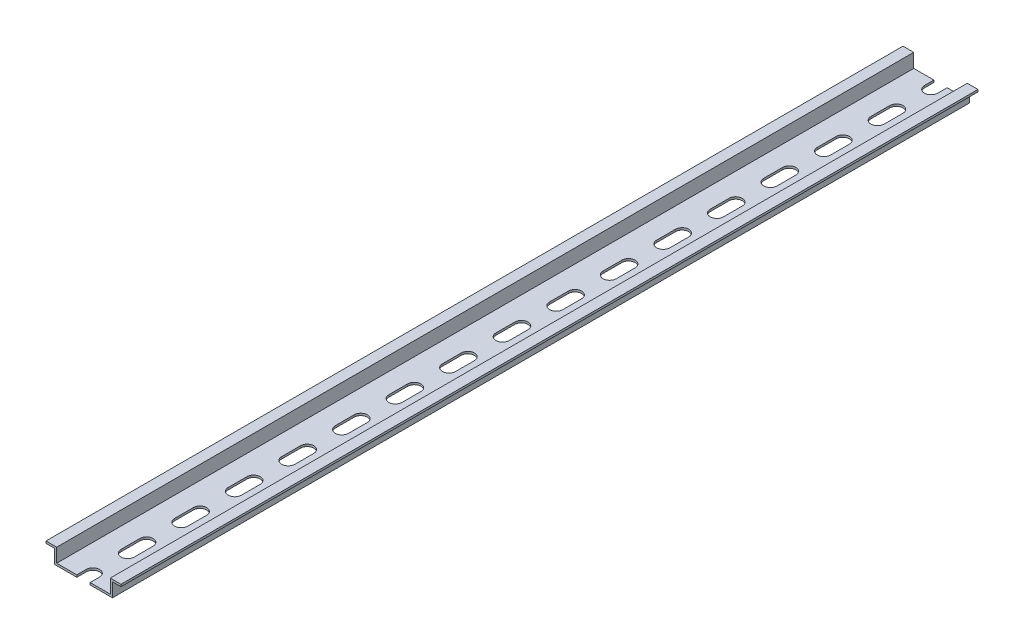
from build123d import *

# Parameters (mm, degrees)
SKETCH1_W           = 35
SKETCH1_H           = 2000
BOSS_EXTRUDE1_DEPTH = 7.5
SKETCH2_W           = 25
SKETCH2_H           = 6.5
CUT_EXTRUDE1_DEPTH  = 2006.509951855
CUT_EXTRUDE2_DEPTH  = 1906.117208871
SKETCH4_W           = 4
SKETCH4_H           = 6.5
CUT_EXTRUDE3_DEPTH  = 2006.509951855
SKETCH5_W           = 4
SKETCH5_H           = 6.5
CUT_EXTRUDE4_DEPTH  = 2006.509951855
CUT_EXTRUDE5_DEPTH  = 1906.117208871
CUT_EXTRUDE6_DEPTH  = 1906.113534553
CUT_EXTRUDE7_DEPTH  = 1906.113534553
CUT_EXTRUDE8_DEPTH  = 1906.113534553
CUT_EXTRUDE9_DEPTH  = 1906.113534553
CUT_EXTRUDE10_DEPTH = 1906.113534553
CUT_EXTRUDE11_DEPTH = 1906.113534553
CUT_EXTRUDE12_DEPTH = 1906.113534553
CUT_EXTRUDE13_DEPTH = 1906.113534553
CUT_EXTRUDE14_DEPTH = 1906.113534553
CUT_EXTRUDE15_DEPTH = 1906.113534553
CUT_EXTRUDE16_DEPTH = 1906.113534553
CUT_EXTRUDE17_DEPTH = 1906.113534553
CUT_EXTRUDE18_DEPTH = 1906.113534553
CUT_EXTRUDE19_DEPTH = 1906.113534553
CUT_EXTRUDE20_DEPTH = 1906.113534553
CUT_EXTRUDE21_DEPTH = 1906.113534553
CUT_EXTRUDE22_DEPTH = 1906.113534553
CUT_EXTRUDE23_DEPTH = 1906.113534553
CUT_EXTRUDE24_DEPTH = 1906.113534553
CUT_EXTRUDE25_DEPTH = 1906.113534553
CUT_EXTRUDE26_DEPTH = 1906.113534553
CUT_EXTRUDE27_DEPTH = 1906.113534553
CUT_EXTRUDE28_DEPTH = 1906.113534553
CUT_EXTRUDE29_DEPTH = 1906.113534553
CUT_EXTRUDE30_DEPTH = 1906.113534553
CUT_EXTRUDE31_DEPTH = 1906.113534553
CUT_EXTRUDE32_DEPTH = 1906.113534553
CUT_EXTRUDE33_DEPTH = 1906.113534553
CUT_EXTRUDE34_DEPTH = 1906.113534553
CUT_EXTRUDE35_DEPTH = 1906.113534553
CUT_EXTRUDE36_DEPTH = 1906.113534553
CUT_EXTRUDE37_DEPTH = 1906.113534553
CUT_EXTRUDE38_DEPTH = 1906.113534553
CUT_EXTRUDE39_DEPTH = 1906.113534553
CUT_EXTRUDE40_DEPTH = 1906.113534553
CUT_EXTRUDE41_DEPTH = 1906.113534553
CUT_EXTRUDE42_DEPTH = 1906.113534553
CUT_EXTRUDE43_DEPTH = 1906.113534553
CUT_EXTRUDE44_DEPTH = 1906.113534553
CUT_EXTRUDE45_DEPTH = 1906.113534553
CUT_EXTRUDE46_DEPTH = 1906.113534553
CUT_EXTRUDE47_DEPTH = 1906.113534553
CUT_EXTRUDE48_DEPTH = 1906.113534553
CUT_EXTRUDE49_DEPTH = 1906.113534553
CUT_EXTRUDE50_DEPTH = 1906.113534553
CUT_EXTRUDE51_DEPTH = 1906.113534553
CUT_EXTRUDE52_DEPTH = 1906.113534553
CUT_EXTRUDE53_DEPTH = 1906.113534553
CUT_EXTRUDE54_DEPTH = 1906.113534553
CUT_EXTRUDE55_DEPTH = 1906.113534553
CUT_EXTRUDE56_DEPTH = 1906.113534553
CUT_EXTRUDE57_DEPTH = 1906.113534553
CUT_EXTRUDE58_DEPTH = 1906.113534553
CUT_EXTRUDE59_DEPTH = 1906.113534553
CUT_EXTRUDE60_DEPTH = 1906.113534553
CUT_EXTRUDE61_DEPTH = 1906.113534553
CUT_EXTRUDE62_DEPTH = 1906.113534553
CUT_EXTRUDE63_DEPTH = 1906.113534553
CUT_EXTRUDE64_DEPTH = 1906.113534553
CUT_EXTRUDE65_DEPTH = 1906.113534553
CUT_EXTRUDE66_DEPTH = 1906.113534553
CUT_EXTRUDE67_DEPTH = 1906.113534553
CUT_EXTRUDE68_DEPTH = 1906.113534553
CUT_EXTRUDE69_DEPTH = 1906.113534553
CUT_EXTRUDE70_DEPTH = 1906.113534553
CUT_EXTRUDE71_DEPTH = 1906.113534553
CUT_EXTRUDE72_DEPTH = 1906.113534553
CUT_EXTRUDE73_DEPTH = 1906.113534553
CUT_EXTRUDE74_DEPTH = 1906.113534553
CUT_EXTRUDE75_DEPTH = 1906.113534553
CUT_EXTRUDE76_DEPTH = 1906.113534553
CUT_EXTRUDE77_DEPTH = 1906.113534553
CUT_EXTRUDE78_DEPTH = 1906.113534553
CUT_EXTRUDE79_DEPTH = 1906.113534553
CUT_EXTRUDE80_DEPTH = 1906.113534553
CUT_EXTRUDE81_DEPTH = 1906.113534553
CUT_EXTRUDE82_DEPTH = 1906.113534553
CUT_EXTRUDE83_DEPTH = 1906.113534553
CUT_EXTRUDE84_DEPTH = 1906.117208871
SKETCH86_W          = 69.374183468
SKETCH86_H          = 40.086929233
CUT_EXTRUDE85_DEPTH = 1600


with BuildPart() as part:
    # Sketch1 → Boss-Extrude1 (new body)
    with BuildSketch(Plane(origin=(0, -44.02511479, 0), x_dir=(1, 0, 0), z_dir=(0, 1, 0))):
        with Locations((121.838901733, 900)):
            Rectangle(SKETCH1_W, SKETCH1_H)
    extrude(amount=-BOSS_EXTRUDE1_DEPTH)

    # Sketch2 → Cut-Extrude1 (cut, through all)
    with BuildSketch(Plane(origin=(0, 0, -1900), x_dir=(-1, 0, 0), z_dir=(0, 0, -1))):
        with Locations((-121.838901733, -47.27511479)):
            Rectangle(SKETCH2_W, SKETCH2_H)
    extrude(amount=-CUT_EXTRUDE1_DEPTH, mode=Mode.SUBTRACT)

    # Sketch3 → Cut-Extrude2 (cut, through all)
    with BuildSketch(Plane.XZ.offset(51.52511479)):
        with BuildLine():
            Line((118.738901733, -1900), (124.938901733, -1900))
            Line((124.938901733, -1900), (124.938901733, -1895.6))
            ThreePointArc((124.938901733, -1895.6), (121.838901733, -1892.5), (118.738901733, -1895.6))
            Line((118.738901733, -1895.6), (118.738901733, -1900))
        make_face()
    extrude(amount=-CUT_EXTRUDE2_DEPTH, mode=Mode.SUBTRACT)

    # Sketch4 → Cut-Extrude3 (cut, through all)
    with BuildSketch(Plane(origin=(0, 0, -1900), x_dir=(-1, 0, 0), z_dir=(0, 0, -1))):
        with Locations((-106.338901733, -48.27511479)):
            Rectangle(SKETCH4_W, SKETCH4_H)
    extrude(amount=-CUT_EXTRUDE3_DEPTH, mode=Mode.SUBTRACT)

    # Sketch5 → Cut-Extrude4 (cut, through all)
    with BuildSketch(Plane(origin=(0, 0, -1900), x_dir=(-1, 0, 0), z_dir=(0, 0, -1))):
        with Locations((-137.338901733, -48.27511479)):
            Rectangle(SKETCH5_W, SKETCH5_H)
    extrude(amount=-CUT_EXTRUDE4_DEPTH, mode=Mode.SUBTRACT)

    # Sketch6 → Cut-Extrude5 (cut, through all)
    with BuildSketch(Plane.XZ.offset(51.52511479)):
        with BuildLine():
            Line((118.738901733, 100), (118.738901733, 95.6))
            ThreePointArc((118.738901733, 95.6), (121.838901733, 92.5), (124.938901733, 95.6))
            Line((124.938901733, 95.6), (124.938901733, 100))
            Line((124.938901733, 100), (118.738901733, 100))
        make_face()
    extrude(amount=-CUT_EXTRUDE5_DEPTH, mode=Mode.SUBTRACT)

    # Sketch7 → Cut-Extrude6 (cut, through all)
    with BuildSketch(Plane(origin=(0, -50.52511479, 0), x_dir=(-1, 0, 0), z_dir=(0, 1, 0))):
        with BuildLine():
            Line((-118.738901733, -54.4), (-118.738901733, -45.6))
            ThreePointArc((-118.738901733, -45.6), (-121.838901733, -42.5), (-124.938901733, -45.6))
            Line((-124.938901733, -45.6), (-124.938901733, -54.4))
            ThreePointArc((-124.938901733, -54.4), (-121.838901733, -57.5), (-118.738901733, -54.4))
        make_face()
    extrude(amount=-CUT_EXTRUDE6_DEPTH, mode=Mode.SUBTRACT)

    # Sketch8 → Cut-Extrude7 (cut, through all)
    with BuildSketch(Plane(origin=(0, -50.52511479, 0), x_dir=(-1, 0, 0), z_dir=(0, 1, 0))):
        with BuildLine():
            Line((-124.938901733, 29.4), (-124.938901733, 20.6))
            ThreePointArc((-124.938901733, 20.6), (-121.838901733, 17.5), (-118.738901733, 20.6))
            Line((-118.738901733, 20.6), (-118.738901733, 29.4))
            ThreePointArc((-118.738901733, 29.4), (-121.838901733, 32.5), (-124.938901733, 29.4))
        make_face()
    extrude(amount=-CUT_EXTRUDE7_DEPTH, mode=Mode.SUBTRACT)

    # Sketch9 → Cut-Extrude8 (cut, through all)
    with BuildSketch(Plane(origin=(0, -50.52511479, 0), x_dir=(-1, 0, 0), z_dir=(0, 1, 0))):
        with BuildLine():
            Line((-118.738901733, -1829.4), (-118.738901733, -1820.6))
            ThreePointArc((-118.738901733, -1820.6), (-121.838901733, -1817.5), (-124.938901733, -1820.6))
            Line((-124.938901733, -1820.6), (-124.938901733, -1829.4))
            ThreePointArc((-124.938901733, -1829.4), (-121.838901733, -1832.5), (-118.738901733, -1829.4))
        make_face()
    extrude(amount=-CUT_EXTRUDE8_DEPTH, mode=Mode.SUBTRACT)

    # Sketch10 → Cut-Extrude9 (cut, through all)
    with BuildSketch(Plane(origin=(0, -50.52511479, 0), x_dir=(-1, 0, 0), z_dir=(0, 1, 0))):
        with BuildLine():
            Line((-118.738901733, -1529.4), (-118.738901733, -1520.6))
            ThreePointArc((-118.738901733, -1520.6), (-121.838901733, -1517.5), (-124.938901733, -1520.6))
            Line((-124.938901733, -1520.6), (-124.938901733, -1529.4))
            ThreePointArc((-124.938901733, -1529.4), (-121.838901733, -1532.5), (-118.738901733, -1529.4))
        make_face()
    extrude(amount=-CUT_EXTRUDE9_DEPTH, mode=Mode.SUBTRACT)

    # Sketch11 → Cut-Extrude10 (cut, through all)
    with BuildSketch(Plane(origin=(0, -50.52511479, 0), x_dir=(-1, 0, 0), z_dir=(0, 1, 0))):
        with BuildLine():
            Line((-124.938901733, -1120.6), (-124.938901733, -1129.4))
            ThreePointArc((-124.938901733, -1129.4), (-121.838901733, -1132.5), (-118.738901733, -1129.4))
            Line((-118.738901733, -1129.4), (-118.738901733, -1120.6))
            ThreePointArc((-118.738901733, -1120.6), (-121.838901733, -1117.5), (-124.938901733, -1120.6))
        make_face()
    extrude(amount=-CUT_EXTRUDE10_DEPTH, mode=Mode.SUBTRACT)

    # Sketch12 → Cut-Extrude11 (cut, through all)
    with BuildSketch(Plane(origin=(0, -50.52511479, 0), x_dir=(-1, 0, 0), z_dir=(0, 1, 0))):
        with BuildLine():
            Line((-118.738901733, -404.4), (-118.738901733, -395.6))
            ThreePointArc((-118.738901733, -395.6), (-121.838901733, -392.5), (-124.938901733, -395.6))
            Line((-124.938901733, -395.6), (-124.938901733, -404.4))
            ThreePointArc((-124.938901733, -404.4), (-121.838901733, -407.5), (-118.738901733, -404.4))
        make_face()
    extrude(amount=-CUT_EXTRUDE11_DEPTH, mode=Mode.SUBTRACT)

    # Sketch13 → Cut-Extrude12 (cut, through all)
    with BuildSketch(Plane(origin=(0, -50.52511479, 0), x_dir=(-1, 0, 0), z_dir=(0, 1, 0))):
        with BuildLine():
            Line((-118.738901733, -304.4), (-118.738901733, -295.6))
            ThreePointArc((-118.738901733, -295.6), (-121.838901733, -292.5), (-124.938901733, -295.6))
            Line((-124.938901733, -295.6), (-124.938901733, -304.4))
            ThreePointArc((-124.938901733, -304.4), (-121.838901733, -307.5), (-118.738901733, -304.4))
        make_face()
    extrude(amount=-CUT_EXTRUDE12_DEPTH, mode=Mode.SUBTRACT)

    # Sketch14 → Cut-Extrude13 (cut, through all)
    with BuildSketch(Plane(origin=(0, -50.52511479, 0), x_dir=(-1, 0, 0), z_dir=(0, 1, 0))):
        with BuildLine():
            Line((-124.938901733, -245.6), (-124.938901733, -254.4))
            ThreePointArc((-124.938901733, -254.4), (-121.838901733, -257.5), (-118.738901733, -254.4))
            Line((-118.738901733, -254.4), (-118.738901733, -245.6))
            ThreePointArc((-118.738901733, -245.6), (-121.838901733, -242.5), (-124.938901733, -245.6))
        make_face()
    extrude(amount=-CUT_EXTRUDE13_DEPTH, mode=Mode.SUBTRACT)

    # Sketch15 → Cut-Extrude14 (cut, through all)
    with BuildSketch(Plane(origin=(0, -50.52511479, 0), x_dir=(-1, 0, 0), z_dir=(0, 1, 0))):
        with BuildLine():
            Line((-118.738901733, 45.6), (-118.738901733, 54.4))
            ThreePointArc((-118.738901733, 54.4), (-121.838901733, 57.5), (-124.938901733, 54.4))
            Line((-124.938901733, 54.4), (-124.938901733, 45.6))
            ThreePointArc((-124.938901733, 45.6), (-121.838901733, 42.5), (-118.738901733, 45.6))
        make_face()
    extrude(amount=-CUT_EXTRUDE14_DEPTH, mode=Mode.SUBTRACT)

    # Sketch16 → Cut-Extrude15 (cut, through all)
    with BuildSketch(Plane(origin=(0, -50.52511479, 0), x_dir=(-1, 0, 0), z_dir=(0, 1, 0))):
        with BuildLine():
            Line((-118.738901733, -279.4), (-118.738901733, -270.6))
            ThreePointArc((-118.738901733, -270.6), (-121.838901733, -267.5), (-124.938901733, -270.6))
            Line((-124.938901733, -270.6), (-124.938901733, -279.4))
            ThreePointArc((-124.938901733, -279.4), (-121.838901733, -282.5), (-118.738901733, -279.4))
        make_face()
    extrude(amount=-CUT_EXTRUDE15_DEPTH, mode=Mode.SUBTRACT)

    # Sketch17 → Cut-Extrude16 (cut, through all)
    with BuildSketch(Plane(origin=(0, -50.52511479, 0), x_dir=(-1, 0, 0), z_dir=(0, 1, 0))):
        with BuildLine():
            Line((-124.938901733, -920.6), (-124.938901733, -929.4))
            ThreePointArc((-124.938901733, -929.4), (-121.838901733, -932.5), (-118.738901733, -929.4))
            Line((-118.738901733, -929.4), (-118.738901733, -920.6))
            ThreePointArc((-118.738901733, -920.6), (-121.838901733, -917.5), (-124.938901733, -920.6))
        make_face()
    extrude(amount=-CUT_EXTRUDE16_DEPTH, mode=Mode.SUBTRACT)

    # Sketch18 → Cut-Extrude17 (cut, through all)
    with BuildSketch(Plane(origin=(0, -50.52511479, 0), x_dir=(-1, 0, 0), z_dir=(0, 1, 0))):
        with BuildLine():
            Line((-118.738901733, -1504.4), (-118.738901733, -1495.6))
            ThreePointArc((-118.738901733, -1495.6), (-121.838901733, -1492.5), (-124.938901733, -1495.6))
            Line((-124.938901733, -1495.6), (-124.938901733, -1504.4))
            ThreePointArc((-124.938901733, -1504.4), (-121.838901733, -1507.5), (-118.738901733, -1504.4))
        make_face()
    extrude(amount=-CUT_EXTRUDE17_DEPTH, mode=Mode.SUBTRACT)

    # Sketch19 → Cut-Extrude18 (cut, through all)
    with BuildSketch(Plane(origin=(0, -50.52511479, 0), x_dir=(-1, 0, 0), z_dir=(0, 1, 0))):
        with BuildLine():
            Line((-124.938901733, -970.6), (-124.938901733, -979.4))
            ThreePointArc((-124.938901733, -979.4), (-121.838901733, -982.5), (-118.738901733, -979.4))
            Line((-118.738901733, -979.4), (-118.738901733, -970.6))
            ThreePointArc((-118.738901733, -970.6), (-121.838901733, -967.5), (-124.938901733, -970.6))
        make_face()
    extrude(amount=-CUT_EXTRUDE18_DEPTH, mode=Mode.SUBTRACT)

    # Sketch20 → Cut-Extrude19 (cut, through all)
    with BuildSketch(Plane(origin=(0, -50.52511479, 0), x_dir=(-1, 0, 0), z_dir=(0, 1, 0))):
        with BuildLine():
            Line((-118.738901733, -204.4), (-118.738901733, -195.6))
            ThreePointArc((-118.738901733, -195.6), (-121.838901733, -192.5), (-124.938901733, -195.6))
            Line((-124.938901733, -195.6), (-124.938901733, -204.4))
            ThreePointArc((-124.938901733, -204.4), (-121.838901733, -207.5), (-118.738901733, -204.4))
        make_face()
    extrude(amount=-CUT_EXTRUDE19_DEPTH, mode=Mode.SUBTRACT)

    # Sketch21 → Cut-Extrude20 (cut, through all)
    with BuildSketch(Plane(origin=(0, -50.52511479, 0), x_dir=(-1, 0, 0), z_dir=(0, 1, 0))):
        with BuildLine():
            Line((-118.738901733, -79.4), (-118.738901733, -70.6))
            ThreePointArc((-118.738901733, -70.6), (-121.838901733, -67.5), (-124.938901733, -70.6))
            Line((-124.938901733, -70.6), (-124.938901733, -79.4))
            ThreePointArc((-124.938901733, -79.4), (-121.838901733, -82.5), (-118.738901733, -79.4))
        make_face()
    extrude(amount=-CUT_EXTRUDE20_DEPTH, mode=Mode.SUBTRACT)

    # Sketch22 → Cut-Extrude21 (cut, through all)
    with BuildSketch(Plane(origin=(0, -50.52511479, 0), x_dir=(-1, 0, 0), z_dir=(0, 1, 0))):
        with BuildLine():
            Line((-118.738901733, -1379.4), (-118.738901733, -1370.6))
            ThreePointArc((-118.738901733, -1370.6), (-121.838901733, -1367.5), (-124.938901733, -1370.6))
            Line((-124.938901733, -1370.6), (-124.938901733, -1379.4))
            ThreePointArc((-124.938901733, -1379.4), (-121.838901733, -1382.5), (-118.738901733, -1379.4))
        make_face()
    extrude(amount=-CUT_EXTRUDE21_DEPTH, mode=Mode.SUBTRACT)

    # Sketch23 → Cut-Extrude22 (cut, through all)
    with BuildSketch(Plane(origin=(0, -50.52511479, 0), x_dir=(-1, 0, 0), z_dir=(0, 1, 0))):
        with BuildLine():
            Line((-118.738901733, -1604.4), (-118.738901733, -1595.6))
            ThreePointArc((-118.738901733, -1595.6), (-121.838901733, -1592.5), (-124.938901733, -1595.6))
            Line((-124.938901733, -1595.6), (-124.938901733, -1604.4))
            ThreePointArc((-124.938901733, -1604.4), (-121.838901733, -1607.5), (-118.738901733, -1604.4))
        make_face()
    extrude(amount=-CUT_EXTRUDE22_DEPTH, mode=Mode.SUBTRACT)

    # Sketch24 → Cut-Extrude23 (cut, through all)
    with BuildSketch(Plane(origin=(0, -50.52511479, 0), x_dir=(-1, 0, 0), z_dir=(0, 1, 0))):
        with BuildLine():
            Line((-118.738901733, -1254.4), (-118.738901733, -1245.6))
            ThreePointArc((-118.738901733, -1245.6), (-121.838901733, -1242.5), (-124.938901733, -1245.6))
            Line((-124.938901733, -1245.6), (-124.938901733, -1254.4))
            ThreePointArc((-124.938901733, -1254.4), (-121.838901733, -1257.5), (-118.738901733, -1254.4))
        make_face()
    extrude(amount=-CUT_EXTRUDE23_DEPTH, mode=Mode.SUBTRACT)

    # Sketch25 → Cut-Extrude24 (cut, through all)
    with BuildSketch(Plane(origin=(0, -50.52511479, 0), x_dir=(-1, 0, 0), z_dir=(0, 1, 0))):
        with BuildLine():
            Line((-118.738901733, -154.4), (-118.738901733, -145.6))
            ThreePointArc((-118.738901733, -145.6), (-121.838901733, -142.5), (-124.938901733, -145.6))
            Line((-124.938901733, -145.6), (-124.938901733, -154.4))
            ThreePointArc((-124.938901733, -154.4), (-121.838901733, -157.5), (-118.738901733, -154.4))
        make_face()
    extrude(amount=-CUT_EXTRUDE24_DEPTH, mode=Mode.SUBTRACT)

    # Sketch26 → Cut-Extrude25 (cut, through all)
    with BuildSketch(Plane(origin=(0, -50.52511479, 0), x_dir=(-1, 0, 0), z_dir=(0, 1, 0))):
        with BuildLine():
            Line((-118.738901733, -1554.4), (-118.738901733, -1545.6))
            ThreePointArc((-118.738901733, -1545.6), (-121.838901733, -1542.5), (-124.938901733, -1545.6))
            Line((-124.938901733, -1545.6), (-124.938901733, -1554.4))
            ThreePointArc((-124.938901733, -1554.4), (-121.838901733, -1557.5), (-118.738901733, -1554.4))
        make_face()
    extrude(amount=-CUT_EXTRUDE25_DEPTH, mode=Mode.SUBTRACT)

    # Sketch27 → Cut-Extrude26 (cut, through all)
    with BuildSketch(Plane(origin=(0, -50.52511479, 0), x_dir=(-1, 0, 0), z_dir=(0, 1, 0))):
        with BuildLine():
            Line((-124.938901733, -1020.6), (-124.938901733, -1029.4))
            ThreePointArc((-124.938901733, -1029.4), (-121.838901733, -1032.5), (-118.738901733, -1029.4))
            Line((-118.738901733, -1029.4), (-118.738901733, -1020.6))
            ThreePointArc((-118.738901733, -1020.6), (-121.838901733, -1017.5), (-124.938901733, -1020.6))
        make_face()
    extrude(amount=-CUT_EXTRUDE26_DEPTH, mode=Mode.SUBTRACT)

    # Sketch28 → Cut-Extrude27 (cut, through all)
    with BuildSketch(Plane(origin=(0, -50.52511479, 0), x_dir=(-1, 0, 0), z_dir=(0, 1, 0))):
        with BuildLine():
            Line((-118.738901733, -1629.4), (-118.738901733, -1620.6))
            ThreePointArc((-118.738901733, -1620.6), (-121.838901733, -1617.5), (-124.938901733, -1620.6))
            Line((-124.938901733, -1620.6), (-124.938901733, -1629.4))
            ThreePointArc((-124.938901733, -1629.4), (-121.838901733, -1632.5), (-118.738901733, -1629.4))
        make_face()
    extrude(amount=-CUT_EXTRUDE27_DEPTH, mode=Mode.SUBTRACT)

    # Sketch29 → Cut-Extrude28 (cut, through all)
    with BuildSketch(Plane(origin=(0, -50.52511479, 0), x_dir=(-1, 0, 0), z_dir=(0, 1, 0))):
        with BuildLine():
            Line((-118.738901733, -529.4), (-118.738901733, -520.6))
            ThreePointArc((-118.738901733, -520.6), (-121.838901733, -517.5), (-124.938901733, -520.6))
            Line((-124.938901733, -520.6), (-124.938901733, -529.4))
            ThreePointArc((-124.938901733, -529.4), (-121.838901733, -532.5), (-118.738901733, -529.4))
        make_face()
    extrude(amount=-CUT_EXTRUDE28_DEPTH, mode=Mode.SUBTRACT)

    # Sketch30 → Cut-Extrude29 (cut, through all)
    with BuildSketch(Plane(origin=(0, -50.52511479, 0), x_dir=(-1, 0, 0), z_dir=(0, 1, 0))):
        with BuildLine():
            Line((-118.738901733, -1104.4), (-118.738901733, -1095.6))
            ThreePointArc((-118.738901733, -1095.6), (-121.838901733, -1092.5), (-124.938901733, -1095.6))
            Line((-124.938901733, -1095.6), (-124.938901733, -1104.4))
            ThreePointArc((-124.938901733, -1104.4), (-121.838901733, -1107.5), (-118.738901733, -1104.4))
        make_face()
    extrude(amount=-CUT_EXTRUDE29_DEPTH, mode=Mode.SUBTRACT)

    # Sketch31 → Cut-Extrude30 (cut, through all)
    with BuildSketch(Plane(origin=(0, -50.52511479, 0), x_dir=(-1, 0, 0), z_dir=(0, 1, 0))):
        with BuildLine():
            Line((-118.738901733, -429.4), (-118.738901733, -420.6))
            ThreePointArc((-118.738901733, -420.6), (-121.838901733, -417.5), (-124.938901733, -420.6))
            Line((-124.938901733, -420.6), (-124.938901733, -429.4))
            ThreePointArc((-124.938901733, -429.4), (-121.838901733, -432.5), (-118.738901733, -429.4))
        make_face()
    extrude(amount=-CUT_EXTRUDE30_DEPTH, mode=Mode.SUBTRACT)

    # Sketch32 → Cut-Extrude31 (cut, through all)
    with BuildSketch(Plane(origin=(0, -50.52511479, 0), x_dir=(-1, 0, 0), z_dir=(0, 1, 0))):
        with BuildLine():
            Line((-118.738901733, -829.4), (-118.738901733, -820.6))
            ThreePointArc((-118.738901733, -820.6), (-121.838901733, -817.5), (-124.938901733, -820.6))
            Line((-124.938901733, -820.6), (-124.938901733, -829.4))
            ThreePointArc((-124.938901733, -829.4), (-121.838901733, -832.5), (-118.738901733, -829.4))
        make_face()
    extrude(amount=-CUT_EXTRUDE31_DEPTH, mode=Mode.SUBTRACT)

    # Sketch33 → Cut-Extrude32 (cut, through all)
    with BuildSketch(Plane(origin=(0, -50.52511479, 0), x_dir=(-1, 0, 0), z_dir=(0, 1, 0))):
        with BuildLine():
            Line((-124.938901733, -870.6), (-124.938901733, -879.4))
            ThreePointArc((-124.938901733, -879.4), (-121.838901733, -882.5), (-118.738901733, -879.4))
            Line((-118.738901733, -879.4), (-118.738901733, -870.6))
            ThreePointArc((-118.738901733, -870.6), (-121.838901733, -867.5), (-124.938901733, -870.6))
        make_face()
    extrude(amount=-CUT_EXTRUDE32_DEPTH, mode=Mode.SUBTRACT)

    # Sketch34 → Cut-Extrude33 (cut, through all)
    with BuildSketch(Plane(origin=(0, -50.52511479, 0), x_dir=(-1, 0, 0), z_dir=(0, 1, 0))):
        with BuildLine():
            Line((-118.738901733, -4.4), (-118.738901733, 4.4))
            ThreePointArc((-118.738901733, 4.4), (-121.838901733, 7.5), (-124.938901733, 4.4))
            Line((-124.938901733, 4.4), (-124.938901733, -4.4))
            ThreePointArc((-124.938901733, -4.4), (-121.838901733, -7.5), (-118.738901733, -4.4))
        make_face()
    extrude(amount=-CUT_EXTRUDE33_DEPTH, mode=Mode.SUBTRACT)

    # Sketch35 → Cut-Extrude34 (cut, through all)
    with BuildSketch(Plane(origin=(0, -50.52511479, 0), x_dir=(-1, 0, 0), z_dir=(0, 1, 0))):
        with BuildLine():
            Line((-118.738901733, -104.4), (-118.738901733, -95.6))
            ThreePointArc((-118.738901733, -95.6), (-121.838901733, -92.5), (-124.938901733, -95.6))
            Line((-124.938901733, -95.6), (-124.938901733, -104.4))
            ThreePointArc((-124.938901733, -104.4), (-121.838901733, -107.5), (-118.738901733, -104.4))
        make_face()
    extrude(amount=-CUT_EXTRUDE34_DEPTH, mode=Mode.SUBTRACT)

    # Sketch36 → Cut-Extrude35 (cut, through all)
    with BuildSketch(Plane(origin=(0, -50.52511479, 0), x_dir=(-1, 0, 0), z_dir=(0, 1, 0))):
        with BuildLine():
            Line((-118.738901733, -754.4), (-118.738901733, -745.6))
            ThreePointArc((-118.738901733, -745.6), (-121.838901733, -742.5), (-124.938901733, -745.6))
            Line((-124.938901733, -745.6), (-124.938901733, -754.4))
            ThreePointArc((-124.938901733, -754.4), (-121.838901733, -757.5), (-118.738901733, -754.4))
        make_face()
    extrude(amount=-CUT_EXTRUDE35_DEPTH, mode=Mode.SUBTRACT)

    # Sketch37 → Cut-Extrude36 (cut, through all)
    with BuildSketch(Plane(origin=(0, -50.52511479, 0), x_dir=(-1, 0, 0), z_dir=(0, 1, 0))):
        with BuildLine():
            Line((-124.938901733, -1570.6), (-124.938901733, -1579.4))
            ThreePointArc((-124.938901733, -1579.4), (-121.838901733, -1582.5), (-118.738901733, -1579.4))
            Line((-118.738901733, -1579.4), (-118.738901733, -1570.6))
            ThreePointArc((-118.738901733, -1570.6), (-121.838901733, -1567.5), (-124.938901733, -1570.6))
        make_face()
    extrude(amount=-CUT_EXTRUDE36_DEPTH, mode=Mode.SUBTRACT)

    # Sketch38 → Cut-Extrude37 (cut, through all)
    with BuildSketch(Plane(origin=(0, -50.52511479, 0), x_dir=(-1, 0, 0), z_dir=(0, 1, 0))):
        with BuildLine():
            Line((-118.738901733, -1404.4), (-118.738901733, -1395.6))
            ThreePointArc((-118.738901733, -1395.6), (-121.838901733, -1392.5), (-124.938901733, -1395.6))
            Line((-124.938901733, -1395.6), (-124.938901733, -1404.4))
            ThreePointArc((-124.938901733, -1404.4), (-121.838901733, -1407.5), (-118.738901733, -1404.4))
        make_face()
    extrude(amount=-CUT_EXTRUDE37_DEPTH, mode=Mode.SUBTRACT)

    # Sketch39 → Cut-Extrude38 (cut, through all)
    with BuildSketch(Plane(origin=(0, -50.52511479, 0), x_dir=(-1, 0, 0), z_dir=(0, 1, 0))):
        with BuildLine():
            Line((-118.738901733, -1329.4), (-118.738901733, -1320.6))
            ThreePointArc((-118.738901733, -1320.6), (-121.838901733, -1317.5), (-124.938901733, -1320.6))
            Line((-124.938901733, -1320.6), (-124.938901733, -1329.4))
            ThreePointArc((-124.938901733, -1329.4), (-121.838901733, -1332.5), (-118.738901733, -1329.4))
        make_face()
    extrude(amount=-CUT_EXTRUDE38_DEPTH, mode=Mode.SUBTRACT)

    # Sketch40 → Cut-Extrude39 (cut, through all)
    with BuildSketch(Plane(origin=(0, -50.52511479, 0), x_dir=(-1, 0, 0), z_dir=(0, 1, 0))):
        with BuildLine():
            Line((-118.738901733, -904.4), (-118.738901733, -895.6))
            ThreePointArc((-118.738901733, -895.6), (-121.838901733, -892.5), (-124.938901733, -895.6))
            Line((-124.938901733, -895.6), (-124.938901733, -904.4))
            ThreePointArc((-124.938901733, -904.4), (-121.838901733, -907.5), (-118.738901733, -904.4))
        make_face()
    extrude(amount=-CUT_EXTRUDE39_DEPTH, mode=Mode.SUBTRACT)

    # Sketch41 → Cut-Extrude40 (cut, through all)
    with BuildSketch(Plane(origin=(0, -50.52511479, 0), x_dir=(-1, 0, 0), z_dir=(0, 1, 0))):
        with BuildLine():
            Line((-118.738901733, -1854.4), (-118.738901733, -1845.6))
            ThreePointArc((-118.738901733, -1845.6), (-121.838901733, -1842.5), (-124.938901733, -1845.6))
            Line((-124.938901733, -1845.6), (-124.938901733, -1854.4))
            ThreePointArc((-124.938901733, -1854.4), (-121.838901733, -1857.5), (-118.738901733, -1854.4))
        make_face()
    extrude(amount=-CUT_EXTRUDE40_DEPTH, mode=Mode.SUBTRACT)

    # Sketch42 → Cut-Extrude41 (cut, through all)
    with BuildSketch(Plane(origin=(0, -50.52511479, 0), x_dir=(-1, 0, 0), z_dir=(0, 1, 0))):
        with BuildLine():
            Line((-124.938901733, -670.6), (-124.938901733, -679.4))
            ThreePointArc((-124.938901733, -679.4), (-121.838901733, -682.5), (-118.738901733, -679.4))
            Line((-118.738901733, -679.4), (-118.738901733, -670.6))
            ThreePointArc((-118.738901733, -670.6), (-121.838901733, -667.5), (-124.938901733, -670.6))
        make_face()
    extrude(amount=-CUT_EXTRUDE41_DEPTH, mode=Mode.SUBTRACT)

    # Sketch43 → Cut-Extrude42 (cut, through all)
    with BuildSketch(Plane(origin=(0, -50.52511479, 0), x_dir=(-1, 0, 0), z_dir=(0, 1, 0))):
        with BuildLine():
            Line((-118.738901733, -1804.4), (-118.738901733, -1795.6))
            ThreePointArc((-118.738901733, -1795.6), (-121.838901733, -1792.5), (-124.938901733, -1795.6))
            Line((-124.938901733, -1795.6), (-124.938901733, -1804.4))
            ThreePointArc((-124.938901733, -1804.4), (-121.838901733, -1807.5), (-118.738901733, -1804.4))
        make_face()
    extrude(amount=-CUT_EXTRUDE42_DEPTH, mode=Mode.SUBTRACT)

    # Sketch44 → Cut-Extrude43 (cut, through all)
    with BuildSketch(Plane(origin=(0, -50.52511479, 0), x_dir=(-1, 0, 0), z_dir=(0, 1, 0))):
        with BuildLine():
            Line((-118.738901733, -229.4), (-118.738901733, -220.6))
            ThreePointArc((-118.738901733, -220.6), (-121.838901733, -217.5), (-124.938901733, -220.6))
            Line((-124.938901733, -220.6), (-124.938901733, -229.4))
            ThreePointArc((-124.938901733, -229.4), (-121.838901733, -232.5), (-118.738901733, -229.4))
        make_face()
    extrude(amount=-CUT_EXTRUDE43_DEPTH, mode=Mode.SUBTRACT)

    # Sketch45 → Cut-Extrude44 (cut, through all)
    with BuildSketch(Plane(origin=(0, -50.52511479, 0), x_dir=(-1, 0, 0), z_dir=(0, 1, 0))):
        with BuildLine():
            Line((-118.738901733, -29.4), (-118.738901733, -20.6))
            ThreePointArc((-118.738901733, -20.6), (-121.838901733, -17.5), (-124.938901733, -20.6))
            Line((-124.938901733, -20.6), (-124.938901733, -29.4))
            ThreePointArc((-124.938901733, -29.4), (-121.838901733, -32.5), (-118.738901733, -29.4))
        make_face()
    extrude(amount=-CUT_EXTRUDE44_DEPTH, mode=Mode.SUBTRACT)

    # Sketch46 → Cut-Extrude45 (cut, through all)
    with BuildSketch(Plane(origin=(0, -50.52511479, 0), x_dir=(-1, 0, 0), z_dir=(0, 1, 0))):
        with BuildLine():
            Line((-124.938901733, -1445.6), (-124.938901733, -1454.4))
            ThreePointArc((-124.938901733, -1454.4), (-121.838901733, -1457.5), (-118.738901733, -1454.4))
            Line((-118.738901733, -1454.4), (-118.738901733, -1445.6))
            ThreePointArc((-118.738901733, -1445.6), (-121.838901733, -1442.5), (-124.938901733, -1445.6))
        make_face()
    extrude(amount=-CUT_EXTRUDE45_DEPTH, mode=Mode.SUBTRACT)

    # Sketch47 → Cut-Extrude46 (cut, through all)
    with BuildSketch(Plane(origin=(0, -50.52511479, 0), x_dir=(-1, 0, 0), z_dir=(0, 1, 0))):
        with BuildLine():
            Line((-118.738901733, -1054.4), (-118.738901733, -1045.6))
            ThreePointArc((-118.738901733, -1045.6), (-121.838901733, -1042.5), (-124.938901733, -1045.6))
            Line((-124.938901733, -1045.6), (-124.938901733, -1054.4))
            ThreePointArc((-124.938901733, -1054.4), (-121.838901733, -1057.5), (-118.738901733, -1054.4))
        make_face()
    extrude(amount=-CUT_EXTRUDE46_DEPTH, mode=Mode.SUBTRACT)

    # Sketch48 → Cut-Extrude47 (cut, through all)
    with BuildSketch(Plane(origin=(0, -50.52511479, 0), x_dir=(-1, 0, 0), z_dir=(0, 1, 0))):
        with BuildLine():
            Line((-124.938901733, -795.6), (-124.938901733, -804.4))
            ThreePointArc((-124.938901733, -804.4), (-121.838901733, -807.5), (-118.738901733, -804.4))
            Line((-118.738901733, -804.4), (-118.738901733, -795.6))
            ThreePointArc((-118.738901733, -795.6), (-121.838901733, -792.5), (-124.938901733, -795.6))
        make_face()
    extrude(amount=-CUT_EXTRUDE47_DEPTH, mode=Mode.SUBTRACT)

    # Sketch49 → Cut-Extrude48 (cut, through all)
    with BuildSketch(Plane(origin=(0, -50.52511479, 0), x_dir=(-1, 0, 0), z_dir=(0, 1, 0))):
        with BuildLine():
            Line((-118.738901733, 70.6), (-118.738901733, 79.4))
            ThreePointArc((-118.738901733, 79.4), (-121.838901733, 82.5), (-124.938901733, 79.4))
            Line((-124.938901733, 79.4), (-124.938901733, 70.6))
            ThreePointArc((-124.938901733, 70.6), (-121.838901733, 67.5), (-118.738901733, 70.6))
        make_face()
    extrude(amount=-CUT_EXTRUDE48_DEPTH, mode=Mode.SUBTRACT)

    # Sketch50 → Cut-Extrude49 (cut, through all)
    with BuildSketch(Plane(origin=(0, -50.52511479, 0), x_dir=(-1, 0, 0), z_dir=(0, 1, 0))):
        with BuildLine():
            Line((-118.738901733, -579.4), (-118.738901733, -570.6))
            ThreePointArc((-118.738901733, -570.6), (-121.838901733, -567.5), (-124.938901733, -570.6))
            Line((-124.938901733, -570.6), (-124.938901733, -579.4))
            ThreePointArc((-124.938901733, -579.4), (-121.838901733, -582.5), (-118.738901733, -579.4))
        make_face()
    extrude(amount=-CUT_EXTRUDE49_DEPTH, mode=Mode.SUBTRACT)

    # Sketch51 → Cut-Extrude50 (cut, through all)
    with BuildSketch(Plane(origin=(0, -50.52511479, 0), x_dir=(-1, 0, 0), z_dir=(0, 1, 0))):
        with BuildLine():
            Line((-118.738901733, -1679.4), (-118.738901733, -1670.6))
            ThreePointArc((-118.738901733, -1670.6), (-121.838901733, -1667.5), (-124.938901733, -1670.6))
            Line((-124.938901733, -1670.6), (-124.938901733, -1679.4))
            ThreePointArc((-124.938901733, -1679.4), (-121.838901733, -1682.5), (-118.738901733, -1679.4))
        make_face()
    extrude(amount=-CUT_EXTRUDE50_DEPTH, mode=Mode.SUBTRACT)

    # Sketch52 → Cut-Extrude51 (cut, through all)
    with BuildSketch(Plane(origin=(0, -50.52511479, 0), x_dir=(-1, 0, 0), z_dir=(0, 1, 0))):
        with BuildLine():
            Line((-124.938901733, -1470.6), (-124.938901733, -1479.4))
            ThreePointArc((-124.938901733, -1479.4), (-121.838901733, -1482.5), (-118.738901733, -1479.4))
            Line((-118.738901733, -1479.4), (-118.738901733, -1470.6))
            ThreePointArc((-118.738901733, -1470.6), (-121.838901733, -1467.5), (-124.938901733, -1470.6))
        make_face()
    extrude(amount=-CUT_EXTRUDE51_DEPTH, mode=Mode.SUBTRACT)

    # Sketch53 → Cut-Extrude52 (cut, through all)
    with BuildSketch(Plane(origin=(0, -50.52511479, 0), x_dir=(-1, 0, 0), z_dir=(0, 1, 0))):
        with BuildLine():
            Line((-118.738901733, -454.4), (-118.738901733, -445.6))
            ThreePointArc((-118.738901733, -445.6), (-121.838901733, -442.5), (-124.938901733, -445.6))
            Line((-124.938901733, -445.6), (-124.938901733, -454.4))
            ThreePointArc((-124.938901733, -454.4), (-121.838901733, -457.5), (-118.738901733, -454.4))
        make_face()
    extrude(amount=-CUT_EXTRUDE52_DEPTH, mode=Mode.SUBTRACT)

    # Sketch54 → Cut-Extrude53 (cut, through all)
    with BuildSketch(Plane(origin=(0, -50.52511479, 0), x_dir=(-1, 0, 0), z_dir=(0, 1, 0))):
        with BuildLine():
            Line((-124.938901733, -995.6), (-124.938901733, -1004.4))
            ThreePointArc((-124.938901733, -1004.4), (-121.838901733, -1007.5), (-118.738901733, -1004.4))
            Line((-118.738901733, -1004.4), (-118.738901733, -995.6))
            ThreePointArc((-118.738901733, -995.6), (-121.838901733, -992.5), (-124.938901733, -995.6))
        make_face()
    extrude(amount=-CUT_EXTRUDE53_DEPTH, mode=Mode.SUBTRACT)

    # Sketch55 → Cut-Extrude54 (cut, through all)
    with BuildSketch(Plane(origin=(0, -50.52511479, 0), x_dir=(-1, 0, 0), z_dir=(0, 1, 0))):
        with BuildLine():
            Line((-118.738901733, -1279.4), (-118.738901733, -1270.6))
            ThreePointArc((-118.738901733, -1270.6), (-121.838901733, -1267.5), (-124.938901733, -1270.6))
            Line((-124.938901733, -1270.6), (-124.938901733, -1279.4))
            ThreePointArc((-124.938901733, -1279.4), (-121.838901733, -1282.5), (-118.738901733, -1279.4))
        make_face()
    extrude(amount=-CUT_EXTRUDE54_DEPTH, mode=Mode.SUBTRACT)

    # Sketch56 → Cut-Extrude55 (cut, through all)
    with BuildSketch(Plane(origin=(0, -50.52511479, 0), x_dir=(-1, 0, 0), z_dir=(0, 1, 0))):
        with BuildLine():
            Line((-118.738901733, -729.4), (-118.738901733, -720.6))
            ThreePointArc((-118.738901733, -720.6), (-121.838901733, -717.5), (-124.938901733, -720.6))
            Line((-124.938901733, -720.6), (-124.938901733, -729.4))
            ThreePointArc((-124.938901733, -729.4), (-121.838901733, -732.5), (-118.738901733, -729.4))
        make_face()
    extrude(amount=-CUT_EXTRUDE55_DEPTH, mode=Mode.SUBTRACT)

    # Sketch57 → Cut-Extrude56 (cut, through all)
    with BuildSketch(Plane(origin=(0, -50.52511479, 0), x_dir=(-1, 0, 0), z_dir=(0, 1, 0))):
        with BuildLine():
            Line((-124.938901733, -645.6), (-124.938901733, -654.4))
            ThreePointArc((-124.938901733, -654.4), (-121.838901733, -657.5), (-118.738901733, -654.4))
            Line((-118.738901733, -654.4), (-118.738901733, -645.6))
            ThreePointArc((-118.738901733, -645.6), (-121.838901733, -642.5), (-124.938901733, -645.6))
        make_face()
    extrude(amount=-CUT_EXTRUDE56_DEPTH, mode=Mode.SUBTRACT)

    # Sketch58 → Cut-Extrude57 (cut, through all)
    with BuildSketch(Plane(origin=(0, -50.52511479, 0), x_dir=(-1, 0, 0), z_dir=(0, 1, 0))):
        with BuildLine():
            Line((-124.938901733, -1645.6), (-124.938901733, -1654.4))
            ThreePointArc((-124.938901733, -1654.4), (-121.838901733, -1657.5), (-118.738901733, -1654.4))
            Line((-118.738901733, -1654.4), (-118.738901733, -1645.6))
            ThreePointArc((-118.738901733, -1645.6), (-121.838901733, -1642.5), (-124.938901733, -1645.6))
        make_face()
    extrude(amount=-CUT_EXTRUDE57_DEPTH, mode=Mode.SUBTRACT)

    # Sketch59 → Cut-Extrude58 (cut, through all)
    with BuildSketch(Plane(origin=(0, -50.52511479, 0), x_dir=(-1, 0, 0), z_dir=(0, 1, 0))):
        with BuildLine():
            Line((-118.738901733, -479.4), (-118.738901733, -470.6))
            ThreePointArc((-118.738901733, -470.6), (-121.838901733, -467.5), (-124.938901733, -470.6))
            Line((-124.938901733, -470.6), (-124.938901733, -479.4))
            ThreePointArc((-124.938901733, -479.4), (-121.838901733, -482.5), (-118.738901733, -479.4))
        make_face()
    extrude(amount=-CUT_EXTRUDE58_DEPTH, mode=Mode.SUBTRACT)

    # Sketch60 → Cut-Extrude59 (cut, through all)
    with BuildSketch(Plane(origin=(0, -50.52511479, 0), x_dir=(-1, 0, 0), z_dir=(0, 1, 0))):
        with BuildLine():
            Line((-124.938901733, -1770.6), (-124.938901733, -1779.4))
            ThreePointArc((-124.938901733, -1779.4), (-121.838901733, -1782.5), (-118.738901733, -1779.4))
            Line((-118.738901733, -1779.4), (-118.738901733, -1770.6))
            ThreePointArc((-118.738901733, -1770.6), (-121.838901733, -1767.5), (-124.938901733, -1770.6))
        make_face()
    extrude(amount=-CUT_EXTRUDE59_DEPTH, mode=Mode.SUBTRACT)

    # Sketch61 → Cut-Extrude60 (cut, through all)
    with BuildSketch(Plane(origin=(0, -50.52511479, 0), x_dir=(-1, 0, 0), z_dir=(0, 1, 0))):
        with BuildLine():
            Line((-118.738901733, -704.4), (-118.738901733, -695.6))
            ThreePointArc((-118.738901733, -695.6), (-121.838901733, -692.5), (-124.938901733, -695.6))
            Line((-124.938901733, -695.6), (-124.938901733, -704.4))
            ThreePointArc((-124.938901733, -704.4), (-121.838901733, -707.5), (-118.738901733, -704.4))
        make_face()
    extrude(amount=-CUT_EXTRUDE60_DEPTH, mode=Mode.SUBTRACT)

    # Sketch62 → Cut-Extrude61 (cut, through all)
    with BuildSketch(Plane(origin=(0, -50.52511479, 0), x_dir=(-1, 0, 0), z_dir=(0, 1, 0))):
        with BuildLine():
            Line((-118.738901733, -854.4), (-118.738901733, -845.6))
            ThreePointArc((-118.738901733, -845.6), (-121.838901733, -842.5), (-124.938901733, -845.6))
            Line((-124.938901733, -845.6), (-124.938901733, -854.4))
            ThreePointArc((-124.938901733, -854.4), (-121.838901733, -857.5), (-118.738901733, -854.4))
        make_face()
    extrude(amount=-CUT_EXTRUDE61_DEPTH, mode=Mode.SUBTRACT)

    # Sketch63 → Cut-Extrude62 (cut, through all)
    with BuildSketch(Plane(origin=(0, -50.52511479, 0), x_dir=(-1, 0, 0), z_dir=(0, 1, 0))):
        with BuildLine():
            Line((-118.738901733, -1179.4), (-118.738901733, -1170.6))
            ThreePointArc((-118.738901733, -1170.6), (-121.838901733, -1167.5), (-124.938901733, -1170.6))
            Line((-124.938901733, -1170.6), (-124.938901733, -1179.4))
            ThreePointArc((-124.938901733, -1179.4), (-121.838901733, -1182.5), (-118.738901733, -1179.4))
        make_face()
    extrude(amount=-CUT_EXTRUDE62_DEPTH, mode=Mode.SUBTRACT)

    # Sketch64 → Cut-Extrude63 (cut, through all)
    with BuildSketch(Plane(origin=(0, -50.52511479, 0), x_dir=(-1, 0, 0), z_dir=(0, 1, 0))):
        with BuildLine():
            Line((-124.938901733, -1720.6), (-124.938901733, -1729.4))
            ThreePointArc((-124.938901733, -1729.4), (-121.838901733, -1732.5), (-118.738901733, -1729.4))
            Line((-118.738901733, -1729.4), (-118.738901733, -1720.6))
            ThreePointArc((-118.738901733, -1720.6), (-121.838901733, -1717.5), (-124.938901733, -1720.6))
        make_face()
    extrude(amount=-CUT_EXTRUDE63_DEPTH, mode=Mode.SUBTRACT)

    # Sketch65 → Cut-Extrude64 (cut, through all)
    with BuildSketch(Plane(origin=(0, -50.52511479, 0), x_dir=(-1, 0, 0), z_dir=(0, 1, 0))):
        with BuildLine():
            Line((-124.938901733, -1195.6), (-124.938901733, -1204.4))
            ThreePointArc((-124.938901733, -1204.4), (-121.838901733, -1207.5), (-118.738901733, -1204.4))
            Line((-118.738901733, -1204.4), (-118.738901733, -1195.6))
            ThreePointArc((-118.738901733, -1195.6), (-121.838901733, -1192.5), (-124.938901733, -1195.6))
        make_face()
    extrude(amount=-CUT_EXTRUDE64_DEPTH, mode=Mode.SUBTRACT)

    # Sketch66 → Cut-Extrude65 (cut, through all)
    with BuildSketch(Plane(origin=(0, -50.52511479, 0), x_dir=(-1, 0, 0), z_dir=(0, 1, 0))):
        with BuildLine():
            Line((-118.738901733, -1704.4), (-118.738901733, -1695.6))
            ThreePointArc((-118.738901733, -1695.6), (-121.838901733, -1692.5), (-124.938901733, -1695.6))
            Line((-124.938901733, -1695.6), (-124.938901733, -1704.4))
            ThreePointArc((-124.938901733, -1704.4), (-121.838901733, -1707.5), (-118.738901733, -1704.4))
        make_face()
    extrude(amount=-CUT_EXTRUDE65_DEPTH, mode=Mode.SUBTRACT)

    # Sketch67 → Cut-Extrude66 (cut, through all)
    with BuildSketch(Plane(origin=(0, -50.52511479, 0), x_dir=(-1, 0, 0), z_dir=(0, 1, 0))):
        with BuildLine():
            Line((-118.738901733, -329.4), (-118.738901733, -320.6))
            ThreePointArc((-118.738901733, -320.6), (-121.838901733, -317.5), (-124.938901733, -320.6))
            Line((-124.938901733, -320.6), (-124.938901733, -329.4))
            ThreePointArc((-124.938901733, -329.4), (-121.838901733, -332.5), (-118.738901733, -329.4))
        make_face()
    extrude(amount=-CUT_EXTRUDE66_DEPTH, mode=Mode.SUBTRACT)

    # Sketch68 → Cut-Extrude67 (cut, through all)
    with BuildSketch(Plane(origin=(0, -50.52511479, 0), x_dir=(-1, 0, 0), z_dir=(0, 1, 0))):
        with BuildLine():
            Line((-118.738901733, -554.4), (-118.738901733, -545.6))
            ThreePointArc((-118.738901733, -545.6), (-121.838901733, -542.5), (-124.938901733, -545.6))
            Line((-124.938901733, -545.6), (-124.938901733, -554.4))
            ThreePointArc((-124.938901733, -554.4), (-121.838901733, -557.5), (-118.738901733, -554.4))
        make_face()
    extrude(amount=-CUT_EXTRUDE67_DEPTH, mode=Mode.SUBTRACT)

    # Sketch69 → Cut-Extrude68 (cut, through all)
    with BuildSketch(Plane(origin=(0, -50.52511479, 0), x_dir=(-1, 0, 0), z_dir=(0, 1, 0))):
        with BuildLine():
            Line((-118.738901733, -379.4), (-118.738901733, -370.6))
            ThreePointArc((-118.738901733, -370.6), (-121.838901733, -367.5), (-124.938901733, -370.6))
            Line((-124.938901733, -370.6), (-124.938901733, -379.4))
            ThreePointArc((-124.938901733, -379.4), (-121.838901733, -382.5), (-118.738901733, -379.4))
        make_face()
    extrude(amount=-CUT_EXTRUDE68_DEPTH, mode=Mode.SUBTRACT)

    # Sketch70 → Cut-Extrude69 (cut, through all)
    with BuildSketch(Plane(origin=(0, -50.52511479, 0), x_dir=(-1, 0, 0), z_dir=(0, 1, 0))):
        with BuildLine():
            Line((-118.738901733, -1229.4), (-118.738901733, -1220.6))
            ThreePointArc((-118.738901733, -1220.6), (-121.838901733, -1217.5), (-124.938901733, -1220.6))
            Line((-124.938901733, -1220.6), (-124.938901733, -1229.4))
            ThreePointArc((-124.938901733, -1229.4), (-121.838901733, -1232.5), (-118.738901733, -1229.4))
        make_face()
    extrude(amount=-CUT_EXTRUDE69_DEPTH, mode=Mode.SUBTRACT)

    # Sketch71 → Cut-Extrude70 (cut, through all)
    with BuildSketch(Plane(origin=(0, -50.52511479, 0), x_dir=(-1, 0, 0), z_dir=(0, 1, 0))):
        with BuildLine():
            Line((-118.738901733, -629.4), (-118.738901733, -620.6))
            ThreePointArc((-118.738901733, -620.6), (-121.838901733, -617.5), (-124.938901733, -620.6))
            Line((-124.938901733, -620.6), (-124.938901733, -629.4))
            ThreePointArc((-124.938901733, -629.4), (-121.838901733, -632.5), (-118.738901733, -629.4))
        make_face()
    extrude(amount=-CUT_EXTRUDE70_DEPTH, mode=Mode.SUBTRACT)

    # Sketch72 → Cut-Extrude71 (cut, through all)
    with BuildSketch(Plane(origin=(0, -50.52511479, 0), x_dir=(-1, 0, 0), z_dir=(0, 1, 0))):
        with BuildLine():
            Line((-118.738901733, -604.4), (-118.738901733, -595.6))
            ThreePointArc((-118.738901733, -595.6), (-121.838901733, -592.5), (-124.938901733, -595.6))
            Line((-124.938901733, -595.6), (-124.938901733, -604.4))
            ThreePointArc((-124.938901733, -604.4), (-121.838901733, -607.5), (-118.738901733, -604.4))
        make_face()
    extrude(amount=-CUT_EXTRUDE71_DEPTH, mode=Mode.SUBTRACT)

    # Sketch73 → Cut-Extrude72 (cut, through all)
    with BuildSketch(Plane(origin=(0, -50.52511479, 0), x_dir=(-1, 0, 0), z_dir=(0, 1, 0))):
        with BuildLine():
            Line((-124.938901733, -1745.6), (-124.938901733, -1754.4))
            ThreePointArc((-124.938901733, -1754.4), (-121.838901733, -1757.5), (-118.738901733, -1754.4))
            Line((-118.738901733, -1754.4), (-118.738901733, -1745.6))
            ThreePointArc((-118.738901733, -1745.6), (-121.838901733, -1742.5), (-124.938901733, -1745.6))
        make_face()
    extrude(amount=-CUT_EXTRUDE72_DEPTH, mode=Mode.SUBTRACT)

    # Sketch74 → Cut-Extrude73 (cut, through all)
    with BuildSketch(Plane(origin=(0, -50.52511479, 0), x_dir=(-1, 0, 0), z_dir=(0, 1, 0))):
        with BuildLine():
            Line((-124.938901733, -1420.6), (-124.938901733, -1429.4))
            ThreePointArc((-124.938901733, -1429.4), (-121.838901733, -1432.5), (-118.738901733, -1429.4))
            Line((-118.738901733, -1429.4), (-118.738901733, -1420.6))
            ThreePointArc((-118.738901733, -1420.6), (-121.838901733, -1417.5), (-124.938901733, -1420.6))
        make_face()
    extrude(amount=-CUT_EXTRUDE73_DEPTH, mode=Mode.SUBTRACT)

    # Sketch75 → Cut-Extrude74 (cut, through all)
    with BuildSketch(Plane(origin=(0, -50.52511479, 0), x_dir=(-1, 0, 0), z_dir=(0, 1, 0))):
        with BuildLine():
            Line((-124.938901733, -1295.6), (-124.938901733, -1304.4))
            ThreePointArc((-124.938901733, -1304.4), (-121.838901733, -1307.5), (-118.738901733, -1304.4))
            Line((-118.738901733, -1304.4), (-118.738901733, -1295.6))
            ThreePointArc((-118.738901733, -1295.6), (-121.838901733, -1292.5), (-124.938901733, -1295.6))
        make_face()
    extrude(amount=-CUT_EXTRUDE74_DEPTH, mode=Mode.SUBTRACT)

    # Sketch76 → Cut-Extrude75 (cut, through all)
    with BuildSketch(Plane(origin=(0, -50.52511479, 0), x_dir=(-1, 0, 0), z_dir=(0, 1, 0))):
        with BuildLine():
            Line((-118.738901733, -179.4), (-118.738901733, -170.6))
            ThreePointArc((-118.738901733, -170.6), (-121.838901733, -167.5), (-124.938901733, -170.6))
            Line((-124.938901733, -170.6), (-124.938901733, -179.4))
            ThreePointArc((-124.938901733, -179.4), (-121.838901733, -182.5), (-118.738901733, -179.4))
        make_face()
    extrude(amount=-CUT_EXTRUDE75_DEPTH, mode=Mode.SUBTRACT)

    # Sketch77 → Cut-Extrude76 (cut, through all)
    with BuildSketch(Plane(origin=(0, -50.52511479, 0), x_dir=(-1, 0, 0), z_dir=(0, 1, 0))):
        with BuildLine():
            Line((-124.938901733, -345.6), (-124.938901733, -354.4))
            ThreePointArc((-124.938901733, -354.4), (-121.838901733, -357.5), (-118.738901733, -354.4))
            Line((-118.738901733, -354.4), (-118.738901733, -345.6))
            ThreePointArc((-118.738901733, -345.6), (-121.838901733, -342.5), (-124.938901733, -345.6))
        make_face()
    extrude(amount=-CUT_EXTRUDE76_DEPTH, mode=Mode.SUBTRACT)

    # Sketch78 → Cut-Extrude77 (cut, through all)
    with BuildSketch(Plane(origin=(0, -50.52511479, 0), x_dir=(-1, 0, 0), z_dir=(0, 1, 0))):
        with BuildLine():
            Line((-118.738901733, -1079.4), (-118.738901733, -1070.6))
            ThreePointArc((-118.738901733, -1070.6), (-121.838901733, -1067.5), (-124.938901733, -1070.6))
            Line((-124.938901733, -1070.6), (-124.938901733, -1079.4))
            ThreePointArc((-124.938901733, -1079.4), (-121.838901733, -1082.5), (-118.738901733, -1079.4))
        make_face()
    extrude(amount=-CUT_EXTRUDE77_DEPTH, mode=Mode.SUBTRACT)

    # Sketch79 → Cut-Extrude78 (cut, through all)
    with BuildSketch(Plane(origin=(0, -50.52511479, 0), x_dir=(-1, 0, 0), z_dir=(0, 1, 0))):
        with BuildLine():
            Line((-118.738901733, -504.4), (-118.738901733, -495.6))
            ThreePointArc((-118.738901733, -495.6), (-121.838901733, -492.5), (-124.938901733, -495.6))
            Line((-124.938901733, -495.6), (-124.938901733, -504.4))
            ThreePointArc((-124.938901733, -504.4), (-121.838901733, -507.5), (-118.738901733, -504.4))
        make_face()
    extrude(amount=-CUT_EXTRUDE78_DEPTH, mode=Mode.SUBTRACT)

    # Sketch80 → Cut-Extrude79 (cut, through all)
    with BuildSketch(Plane(origin=(0, -50.52511479, 0), x_dir=(-1, 0, 0), z_dir=(0, 1, 0))):
        with BuildLine():
            Line((-118.738901733, -129.4), (-118.738901733, -120.6))
            ThreePointArc((-118.738901733, -120.6), (-121.838901733, -117.5), (-124.938901733, -120.6))
            Line((-124.938901733, -120.6), (-124.938901733, -129.4))
            ThreePointArc((-124.938901733, -129.4), (-121.838901733, -132.5), (-118.738901733, -129.4))
        make_face()
    extrude(amount=-CUT_EXTRUDE79_DEPTH, mode=Mode.SUBTRACT)

    # Sketch81 → Cut-Extrude80 (cut, through all)
    with BuildSketch(Plane(origin=(0, -50.52511479, 0), x_dir=(-1, 0, 0), z_dir=(0, 1, 0))):
        with BuildLine():
            Line((-124.938901733, -1870.6), (-124.938901733, -1879.4))
            ThreePointArc((-124.938901733, -1879.4), (-121.838901733, -1882.5), (-118.738901733, -1879.4))
            Line((-118.738901733, -1879.4), (-118.738901733, -1870.6))
            ThreePointArc((-118.738901733, -1870.6), (-121.838901733, -1867.5), (-124.938901733, -1870.6))
        make_face()
    extrude(amount=-CUT_EXTRUDE80_DEPTH, mode=Mode.SUBTRACT)

    # Sketch82 → Cut-Extrude81 (cut, through all)
    with BuildSketch(Plane(origin=(0, -50.52511479, 0), x_dir=(-1, 0, 0), z_dir=(0, 1, 0))):
        with BuildLine():
            Line((-118.738901733, -1154.4), (-118.738901733, -1145.6))
            ThreePointArc((-118.738901733, -1145.6), (-121.838901733, -1142.5), (-124.938901733, -1145.6))
            Line((-124.938901733, -1145.6), (-124.938901733, -1154.4))
            ThreePointArc((-124.938901733, -1154.4), (-121.838901733, -1157.5), (-118.738901733, -1154.4))
        make_face()
    extrude(amount=-CUT_EXTRUDE81_DEPTH, mode=Mode.SUBTRACT)

    # Sketch83 → Cut-Extrude82 (cut, through all)
    with BuildSketch(Plane(origin=(0, -50.52511479, 0), x_dir=(-1, 0, 0), z_dir=(0, 1, 0))):
        with BuildLine():
            Line((-124.938901733, -1345.6), (-124.938901733, -1354.4))
            ThreePointArc((-124.938901733, -1354.4), (-121.838901733, -1357.5), (-118.738901733, -1354.4))
            Line((-118.738901733, -1354.4), (-118.738901733, -1345.6))
            ThreePointArc((-118.738901733, -1345.6), (-121.838901733, -1342.5), (-124.938901733, -1345.6))
        make_face()
    extrude(amount=-CUT_EXTRUDE82_DEPTH, mode=Mode.SUBTRACT)

    # Sketch84 → Cut-Extrude83 (cut, through all)
    with BuildSketch(Plane(origin=(0, -50.52511479, 0), x_dir=(-1, 0, 0), z_dir=(0, 1, 0))):
        with BuildLine():
            Line((-118.738901733, -954.4), (-118.738901733, -945.6))
            ThreePointArc((-118.738901733, -945.6), (-121.838901733, -942.5), (-124.938901733, -945.6))
            Line((-124.938901733, -945.6), (-124.938901733, -954.4))
            ThreePointArc((-124.938901733, -954.4), (-121.838901733, -957.5), (-118.738901733, -954.4))
        make_face()
    extrude(amount=-CUT_EXTRUDE83_DEPTH, mode=Mode.SUBTRACT)

    # Sketch85 → Cut-Extrude84 (cut, through all)
    with BuildSketch(Plane.XZ.offset(51.52511479)):
        with BuildLine():
            Line((124.938901733, -779.4), (124.938901733, -770.6))
            ThreePointArc((124.938901733, -770.6), (121.838901733, -767.5), (118.738901733, -770.6))
            Line((118.738901733, -770.6), (118.738901733, -779.4))
            ThreePointArc((118.738901733, -779.4), (121.838901733, -782.5), (124.938901733, -779.4))
        make_face()
    extrude(amount=-CUT_EXTRUDE84_DEPTH, mode=Mode.SUBTRACT)

    # Sketch86 → Cut-Extrude85 (cut)
    with BuildSketch(Plane(origin=(0, 0, -1900), x_dir=(-1, 0, 0), z_dir=(0, 0, -1))):
        with Locations((-126.872648555, -51.436021569)):
            Rectangle(SKETCH86_W, SKETCH86_H)
    extrude(amount=-CUT_EXTRUDE85_DEPTH, mode=Mode.SUBTRACT)


solid = part.part
